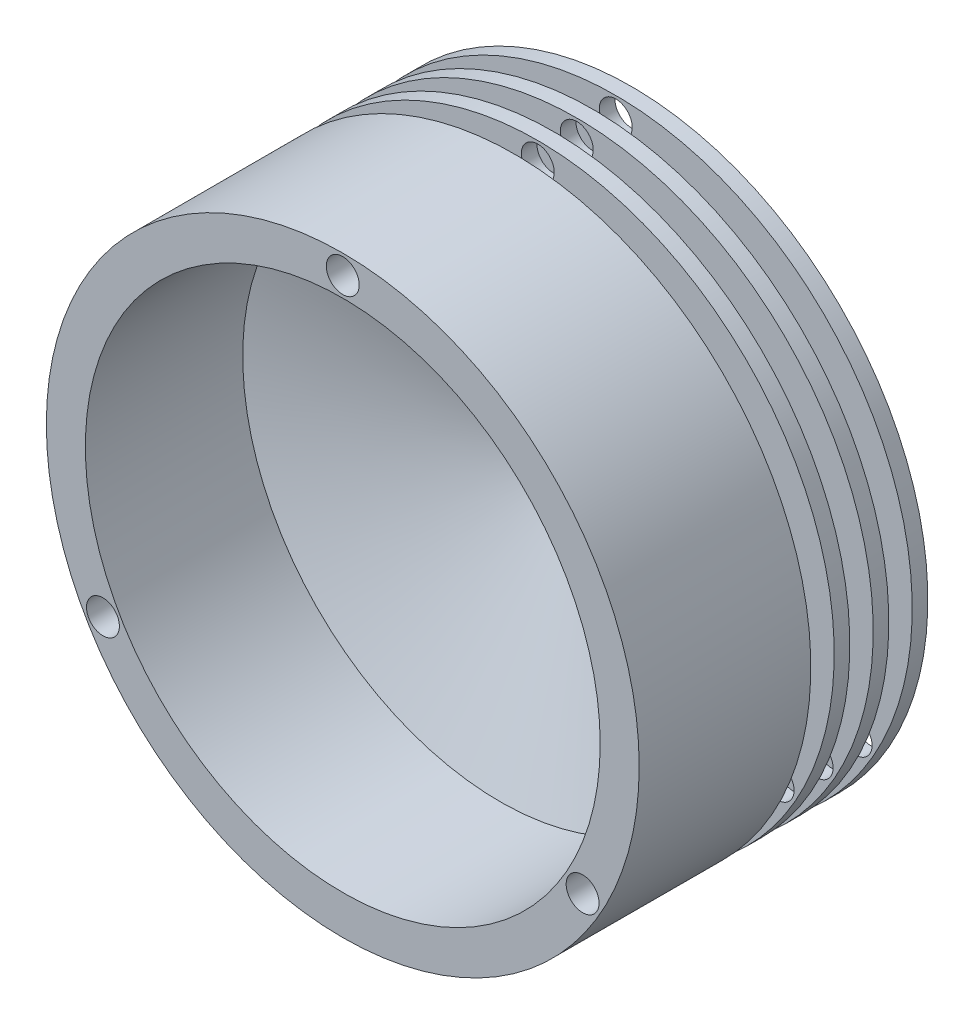
from build123d import *

# Parameters (mm, degrees)
SKETCH1_R                     = 38
SKETCH1_R_2                   = 33
BOSS_EXTRUDE1_DEPTH           = 20
BOSS_EXTRUDE2_START           = 20
SKETCH4_R                     = 38
SKETCH4_R_2                   = 6
BOSS_EXTRUDE2_DEPTH           = 20
CHAMFER1_SIZE                 = 10
CHAMFER1_SIZE_2               = 27.474774195
SKETCH5_R                     = 38
SKETCH5_R_2                   = 29
CUT_EXTRUDE1_DEPTH            = 3
LPATTERN1_COUNT               = 4
LPATTERN1_PITCH               = 5
HOLE_FOR_4_300_SC_NUTS_SP_1_D = 4.2164
CIRPATTERN1_COUNT             = 3


with BuildPart() as part:
    # Sketch1 → Boss-Extrude1 (new body)
    with BuildSketch(Plane.XY):
        Circle(SKETCH1_R)
        Circle(SKETCH1_R_2, mode=Mode.SUBTRACT)
    extrude(amount=BOSS_EXTRUDE1_DEPTH)

    # Sketch4 → Boss-Extrude2 (add)
    with BuildSketch(Plane(origin=(0, 0, 0), x_dir=(-1, 0, 0), z_dir=(0, 0, -1)).offset(BOSS_EXTRUDE2_START)):
        Circle(SKETCH4_R)
        Circle(SKETCH4_R_2, mode=Mode.SUBTRACT)
    extrude(amount=-BOSS_EXTRUDE2_DEPTH)

    # Chamfer1
    # the kernel refuses this chamfer: 27.474774195, 10 mm, written as the material it takes off along each edge
    with BuildSketch(Plane(origin=(0, 0, 0), x_dir=(-1, 0, 0), z_dir=(0, -1, 0))) as chamfer1_piece_1_section:
        Polygon((6, CHAMFER1_SIZE), (6 + CHAMFER1_SIZE_2, 0), (6, 0), align=None)
    chamfer1_piece_1 = revolve(axis=Axis((0, 0, 0), (0, 0, -1)), mode=Mode.PRIVATE)
    chamfer1_piece_1 = chamfer1_piece_1 & Plane(origin=(0, 0, -5.040402046), x_dir=(1, 0, 0), z_dir=(0, 0, -1)) * Cylinder(33, 134, mode=Mode.PRIVATE)
    add(chamfer1_piece_1, mode=Mode.SUBTRACT)

    # Sketch5 → Cut-Extrude1 (cut)
    with BuildSketch(Plane(origin=(0, 0, -20), x_dir=(-1, 0, 0), z_dir=(0, 0, -1))):
        Circle(SKETCH5_R)
        Circle(SKETCH5_R_2, mode=Mode.SUBTRACT)
    cut_extrude1 = extrude(amount=-CUT_EXTRUDE1_DEPTH, mode=Mode.SUBTRACT)

    # LPattern1: Cut-Extrude1 ×4
    with Locations(*[(0, 0, i * LPATTERN1_PITCH) for i in range(1, LPATTERN1_COUNT)]):
        add(cut_extrude1, mode=Mode.SUBTRACT)

    # Hole for #4 300® SC Nuts (SP)1 (through all)
    with Locations(Plane.XY.offset(20)):
        with Locations((0, 35.5)):
            hole_for_4_300_sc_nuts_sp_1 = Hole(HOLE_FOR_4_300_SC_NUTS_SP_1_D / 2)

    # CirPattern1: Hole for #4 300® SC Nuts (SP)1 ×3 about axis
    cirpattern1_axis = Axis((0, 0, 0), (0, 0, 1))
    for i in range(1, CIRPATTERN1_COUNT):
        add(hole_for_4_300_sc_nuts_sp_1.rotate(cirpattern1_axis, i * 360 / CIRPATTERN1_COUNT), mode=Mode.SUBTRACT)


solid = part.part
